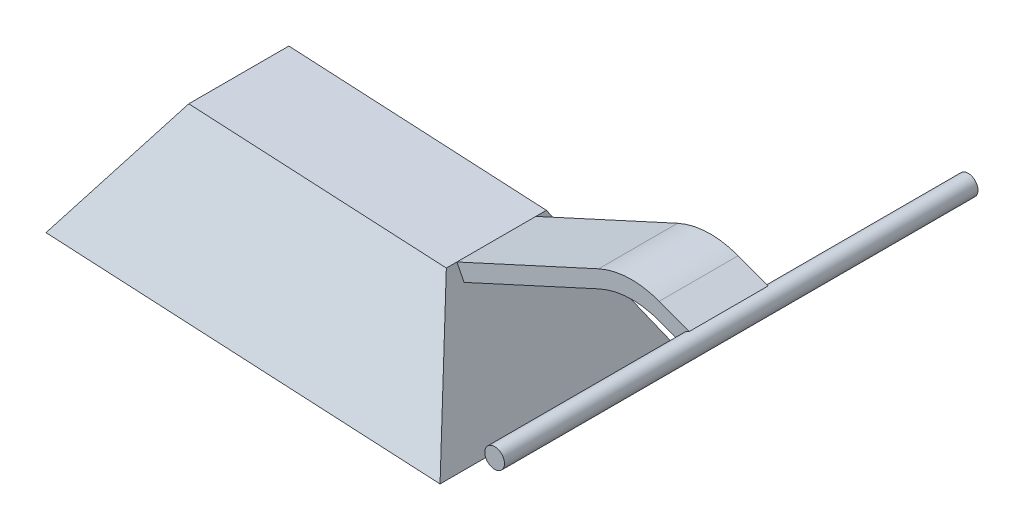
from build123d import *

# Parameters (mm, degrees)
SKETCH_1_W        = 50
SKETCH_1_H        = 30
EXTRUDE_1_DEPTH   = 15
EXTRUDE_1_DRAFT   = -30
SKETCH_2_R        = 1.25
EXTRUDE_2_DEPTH   = 30
EXTRUDE_1_2_DEPTH = 5
FILLET_1_R        = 10


with BuildPart() as part:
    # 草图1 → Extrude 1 (with draft: the straight prism first)
    with BuildSketch(Plane(origin=(85.941069994, -2.250446118, 0), x_dir=(-0.9986295347545743, 0.052335956242936806, 0), z_dir=(-0.05233595624293681, -0.9986295347545744, 0))):
        with Locations((85.941069994, 0)):
            Rectangle(SKETCH_1_W, SKETCH_1_H)
    extrude(amount=-EXTRUDE_1_DEPTH)
    # Extrude 1: the draft: its side faces are tilted about the plane it starts from
    extrude_1_sides = [part.faces().sort_by_distance(p)[0] for p in [
        (0.510298921, 9.737083471, 15),
        (-24.455439447, 11.045482377, 0),
        (0.510298921, 9.737083471, -15),
        (25.47603729, 8.428684565, 0),
    ]]
    draft(extrude_1_sides, Plane(origin=(85.941069994, -2.250446118, 0), x_dir=(-0.9986295347545743, 0.052335956242936806, 0), z_dir=(-0.05233595624293681, -0.9986295347545744, 0)), EXTRUDE_1_DRAFT)


with BuildPart() as body_2:
    # 草图2 → 凸台-拉伸2 (new, symmetric)
    with BuildSketch(Plane.XY):
        with Locations((47, 22.25)):
            Circle(SKETCH_2_R)
    extrude(amount=EXTRUDE_2_DEPTH, both=True)

    # 草图3 → Extrude 1 2 (add, symmetric)
    with BuildSketch(Plane.XY):
        Polygon((16.526408088, 13.85389938), (39.038351514, 24.167617714), (46.648876558, 21.313670822), (47.351123442, 23.186329178), (38.961648486, 26.332382286), (15.693382736, 15.672159197), align=None)
    extrude(amount=EXTRUDE_1_2_DEPTH, both=True)

    # 圆角1
    fillet_1_edges = [body_2.edges().sort_by_distance(p)[0] for p in [
        (39.038351514, 24.167617714, 0),
        (38.961648486, 26.332382286, 0),
    ]]
    fillet(fillet_1_edges, radius=FILLET_1_R)


solid = Compound([part.part, body_2.part])
